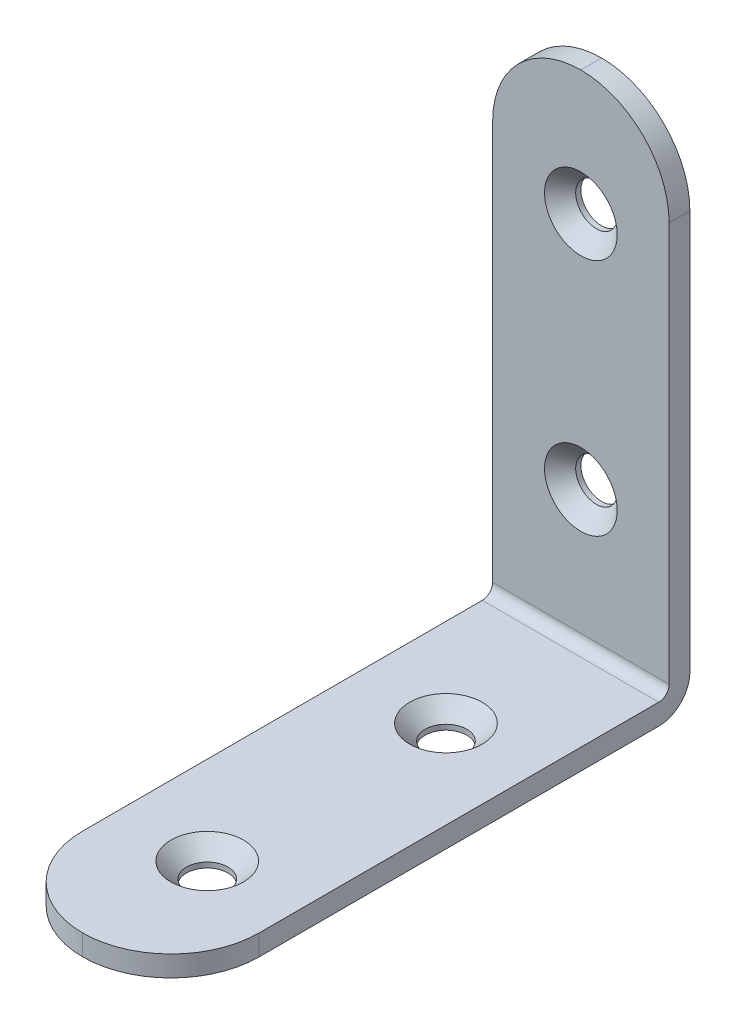
from build123d import *

# Parameters (mm, degrees)
EXTRUDE_1_DEPTH      = 8.5
EXTRUDE_1_DEPTH_BACK = 8.5
SKETCH_3_R           = 2
CUT_EXTRUDE_2_DEPTH  = 15.5
SKETCH_4_R           = 2
CUT_EXTRUDE_3_DEPTH  = 15.5
FILLET_1_R           = 8.5
CHAMFER_1_SIZE       = 1.5


with BuildPart() as part:
    # 草图1 → 凸台-拉伸1 (new, two sides: drawn at the far end of the back side and taken through both)
    with BuildSketch(Plane(origin=(0, 0, 0), x_dir=(0, 0, -1), z_dir=(1, 0, 0)).offset(-EXTRUDE_1_DEPTH_BACK)):
        with BuildLine():
            Line((-50, 0), (-3, 0))
            ThreePointArc((-3, 0), (-0.878679656, 0.878679656), (0, 3))
            Line((0, 3), (0, 50))
            Line((0, 50), (-2, 50))
            Line((-2, 50), (-2, 3))
            ThreePointArc((-2, 3), (-2.292893219, 2.292893219), (-3, 2))
            Line((-3, 2), (-50, 2))
            Line((-50, 2), (-50, 0))
        make_face()
    extrude(amount=EXTRUDE_1_DEPTH + EXTRUDE_1_DEPTH_BACK)

    # 草图3 → 切除-拉伸2 (cut)
    with BuildSketch(Plane(origin=(0, 2, 0), x_dir=(1, 0, 0), z_dir=(0, 1, 0))):
        with Locations(Location((0, -38, 0), (0, 0, 270))):
            Circle(SKETCH_3_R)
        with Locations(Location((0, -15, 0), (0, 0, 270))):
            Circle(SKETCH_3_R)
    extrude(amount=-CUT_EXTRUDE_2_DEPTH, mode=Mode.SUBTRACT)

    # 草图4 → 切除-拉伸3 (cut)
    with BuildSketch(Plane.XY.offset(2)):
        with Locations((0, 38)):
            Circle(SKETCH_4_R)
        with Locations((0, 15)):
            Circle(SKETCH_4_R)
    extrude(amount=-CUT_EXTRUDE_3_DEPTH, mode=Mode.SUBTRACT)

    # 圆角1
    fillet_1_edges = [part.edges().sort_by_distance(p)[0] for p in [
        (8.5, 50, 1),
        (-8.5, 50, 1),
        (8.5, 1, 50),
        (-8.5, 1, 50),
    ]]
    fillet(fillet_1_edges, radius=FILLET_1_R - 0.0001)  # a hair under: the kernel refuses the full size

    # 倒角1
    chamfer_1_edges = [part.edges().sort_by_distance(p)[0] for p in [
        (0, 2, 36),
        (0, 2, 13),
        (-2, 38, 2),
        (-2, 15, 2),
    ]]
    chamfer(chamfer_1_edges, length=CHAMFER_1_SIZE)


solid = part.part
